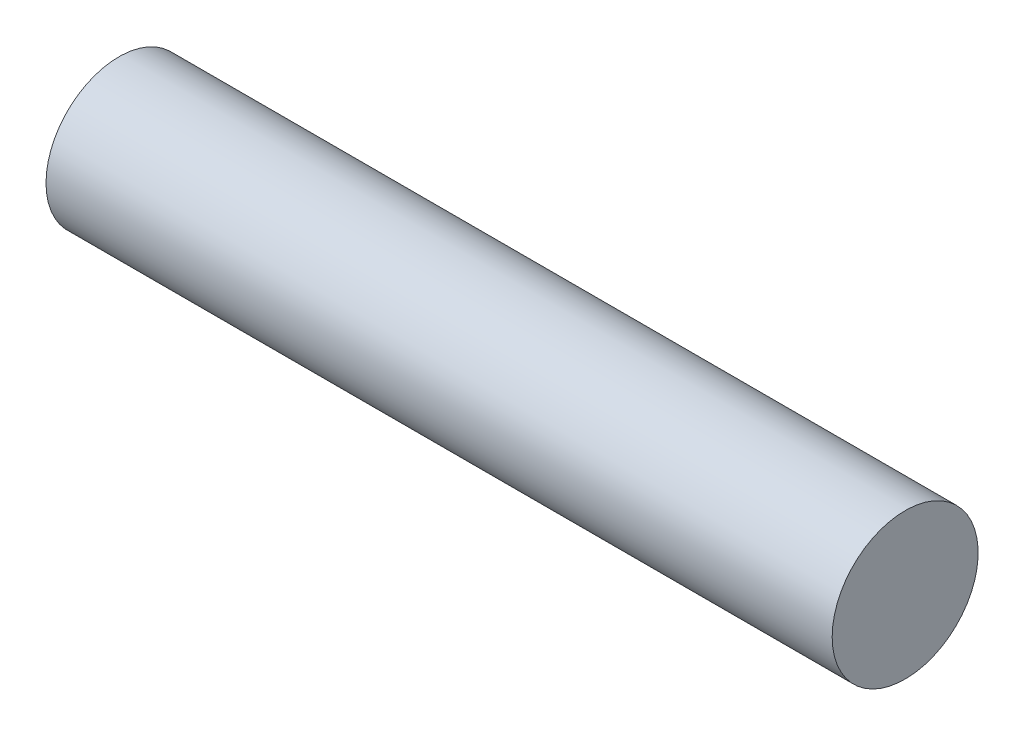
from build123d import *

# Parameters (mm, degrees)
ESQUISSE1_W = 476.853743392
ESQUISSE1_H = 44.271024872


with BuildPart() as part:
    # Esquisse1 → Révolution1 (revolve)
    with BuildSketch(Plane.XY):
        with Locations((-272.618717632, 16.895855249)):
            Rectangle(ESQUISSE1_W, ESQUISSE1_H)
    revolve(axis=Axis((-511.045589328, -5.239657187, 0), (1, 0, 0)))


solid = part.part
